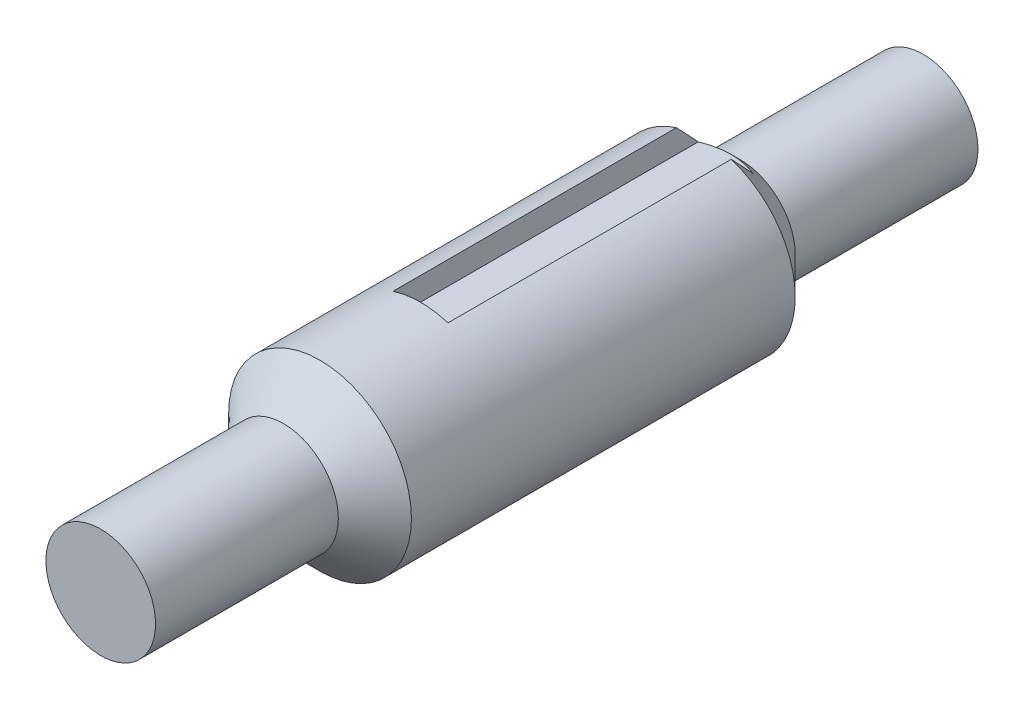
from build123d import *

# Parameters (mm, degrees)
SKETCH2_R               = 10
BOSS_EXTRUDE1_DEPTH     = 30
SKETCH5_R               = 6
BOSS_EXTRUDE3_DEPTH     = 30
CHAMFER2_SIZE           = 10
CUT_EXTRUDE1_DEPTH      = 25
CUT_EXTRUDE1_DEPTH_BACK = 34.166247904
SKETCH3_W               = 6
SKETCH3_H               = 6
BOSS_EXTRUDE4_START     = 60
SKETCH5_3_R             = 6
BOSS_EXTRUDE4_DEPTH     = 30
CHAMFER3_SIZE           = 10


with BuildPart() as part:
    # Sketch2 → Boss-Extrude1 (new body)
    with BuildSketch(Plane.XY):
        Circle(SKETCH2_R)
    extrude(amount=BOSS_EXTRUDE1_DEPTH)

    # Sketch5 → Boss-Extrude3 (add)
    with BuildSketch(Plane.XY):
        Circle(SKETCH5_R)
    extrude(amount=-BOSS_EXTRUDE3_DEPTH)

    # Chamfer2
    # the kernel refuses this chamfer: 10 mm, written as the material it adds along each edge
    with BuildSketch(Plane(origin=(0, 0, 0), x_dir=(1, 0, 0), z_dir=(0, -1, 0))) as chamfer2_piece_1_section:
        Polygon((6 + CHAMFER2_SIZE, 0), (6, -CHAMFER2_SIZE), (6, 0), align=None)
    chamfer2_piece_1 = revolve(axis=Axis((0, 0, 0), (0, 0, 1)), mode=Mode.PRIVATE)
    chamfer2_piece_1 = chamfer2_piece_1 & Plane(origin=(0, 0, -8.05698811), x_dir=(1, 0, 0), z_dir=(0, 0, -1)) * Cylinder(10, 64, mode=Mode.PRIVATE)
    add(chamfer2_piece_1)

    # Sketch3 → Cut-Extrude1 (cut, two sides: drawn at the far end of the back side and taken through both)
    with BuildSketch(Plane.XY.offset(-CUT_EXTRUDE1_DEPTH_BACK)):
        with Locations((0, 10)):
            Rectangle(SKETCH3_W, SKETCH3_H)
    extrude(amount=CUT_EXTRUDE1_DEPTH + CUT_EXTRUDE1_DEPTH_BACK, mode=Mode.SUBTRACT)

    # Sketch5<3> → Boss-Extrude4 (add)
    with BuildSketch(Plane.XY.offset(BOSS_EXTRUDE4_START)):
        Circle(SKETCH5_3_R)
    extrude(amount=-BOSS_EXTRUDE4_DEPTH)

    # Chamfer3
    # the kernel refuses this chamfer: 10 mm, written as the material it adds along each edge
    with BuildSketch(Plane(origin=(0, 0, 30), x_dir=(1, 0, 0), z_dir=(0, -1, 0))) as chamfer3_piece_1_section:
        Polygon((6 + CHAMFER3_SIZE, 0), (6, CHAMFER3_SIZE), (6, 0), align=None)
    chamfer3_piece_1 = revolve(axis=Axis((0, 0, 30), (0, 0, 1)), mode=Mode.PRIVATE)
    chamfer3_piece_1 = chamfer3_piece_1 & Plane(origin=(0, 0, 38.05698811), x_dir=(1, 0, 0), z_dir=(0, 0, -1)) * Cylinder(10, 64, mode=Mode.PRIVATE)
    add(chamfer3_piece_1)


solid = part.part
